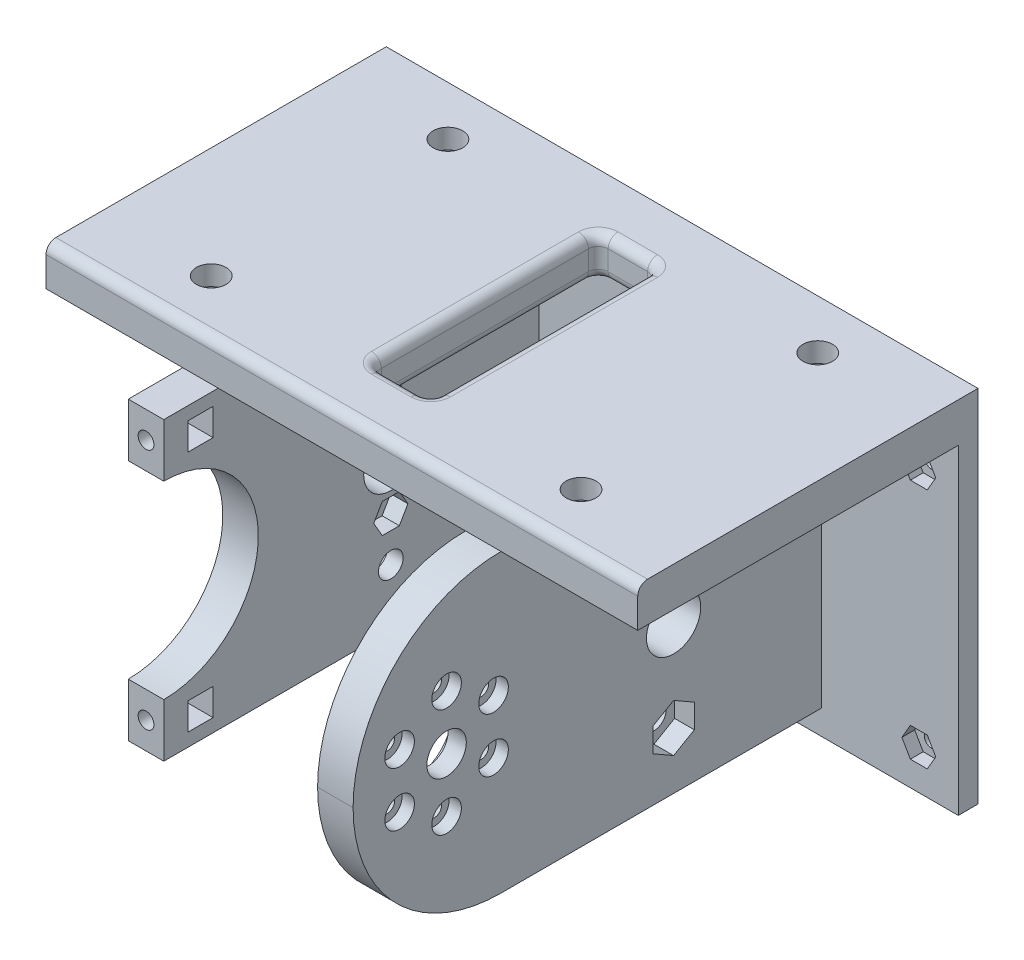
from build123d import *

# Parameters (mm, degrees)
SKETCH1_W               = 120
SKETCH1_H               = 70
SKETCH1_R               = 3
SKETCH1_W_2             = 12
SKETCH1_H_2             = 46
BOSS_EXTRUDE1_DEPTH     = 8
FILLET1_R               = 2
SKETCH2_W               = 120
SKETCH2_H               = 5
BOSS_EXTRUDE2_DEPTH     = 65
SKETCH3_W               = 7.2
SKETCH3_H               = 60
BOSS_EXTRUDE3_DEPTH     = 45
CUT_EXTRUDE1_DEPTH      = 119.172228654
CUT_EXTRUDE1_DEPTH_BACK = 119.172228654
SKETCH4_R               = 5.5
SKETCH4_R_2             = 2.5
CUT_EXTRUDE2_DEPTH      = 4
CUT_EXTRUDE3_DEPTH      = 4
CUT_EXTRUDE4_DEPTH      = 4
FILLET3_R               = 2
SKETCH10_W              = 7.2
SKETCH10_H              = 60
BOSS_EXTRUDE4_DEPTH     = 50
SKETCH11_R              = 4
CUT_EXTRUDE7_DEPTH      = 131.248514867
SKETCH13_R              = 1.5
CUT_EXTRUDE8_DEPTH      = 7.2
SKETCH16_R              = 1.5
CUT_EXTRUDE10_DEPTH     = 7.2
CUT_EXTRUDE11_DEPTH     = 3.5
SKETCH20_R              = 19.175
CUT_EXTRUDE12_DEPTH     = 7.2
SKETCH21_R              = 8.5
CUT_EXTRUDE13_DEPTH     = 3.5
CUT_EXTRUDE14_DEPTH     = 7.2
FILLET4_R               = 30
SKETCH25_R              = 3
CUT_EXTRUDE16_DEPTH     = 2.5
SKETCH26_W              = 5.1
SKETCH26_H              = 5.5
CUT_EXTRUDE17_DEPTH     = 7.2
SKETCH28_R              = 1.6
CUT_EXTRUDE18_DEPTH     = 10
SKETCH29_R              = 1.5
CUT_EXTRUDE19_DEPTH     = 10
CUT_EXTRUDE20_DEPTH     = 2.6
CHAMFER1_SIZE           = 1


with BuildPart() as part:
    # Sketch1 → Boss-Extrude1 (new body)
    with BuildSketch(Plane(origin=(0, 0, 0), x_dir=(1, 0, 0), z_dir=(0, 1, 0))):
        Rectangle(SKETCH1_W, SKETCH1_H)
        with Locations(Location((-37.5, 24, 0), (0, 0, 270))):
            Circle(SKETCH1_R, mode=Mode.SUBTRACT)
        with Locations(Location((-37.5, -24, 0), (0, 0, 90))):
            Circle(SKETCH1_R, mode=Mode.SUBTRACT)
        with Locations(Location((37.5, 24, 0), (0, 0, 90))):
            Circle(SKETCH1_R, mode=Mode.SUBTRACT)
        with Locations(Location((37.5, -24, 0), (0, 0, 270))):
            Circle(SKETCH1_R, mode=Mode.SUBTRACT)
        Rectangle(SKETCH1_W_2, SKETCH1_H_2, mode=Mode.SUBTRACT)
    extrude(amount=BOSS_EXTRUDE1_DEPTH)

    # Fillet1
    fillet1_edges = [part.edges().sort_by_distance(p)[0] for p in [
        (-6, 4, -23),
        (-6, 4, 23),
        (6, 4, 23),
        (6, 4, -23),
    ]]
    fillet(fillet1_edges, radius=FILLET1_R)

    # Sketch2 → Boss-Extrude2 (add)
    with BuildSketch(Plane.XZ):
        with Locations((0, -32.5)):
            Rectangle(SKETCH2_W, SKETCH2_H)
    extrude(amount=BOSS_EXTRUDE2_DEPTH)

    # Sketch3 → Boss-Extrude3 (add)
    with BuildSketch(Plane.XY.offset(-30)):
        with Locations((-28.675, -30)):
            Rectangle(SKETCH3_W, SKETCH3_H)
        with Locations((28.675, -30)):
            Rectangle(SKETCH3_W, SKETCH3_H)
    extrude(amount=BOSS_EXTRUDE3_DEPTH)

    # Sketch4 → Cut-Extrude1 (cut, two sides: drawn at the far end of the back side and taken through both)
    with BuildSketch(Plane.ZY.offset(32.275).offset(-CUT_EXTRUDE1_DEPTH_BACK)):
        with Locations((0, -30)):
            Circle(SKETCH4_R)
        with Locations((0, -11.5)):
            Circle(SKETCH4_R_2)
        with Locations((0, -48.5)):
            Circle(SKETCH4_R_2)
    extrude(amount=CUT_EXTRUDE1_DEPTH + CUT_EXTRUDE1_DEPTH_BACK, mode=Mode.SUBTRACT)

    # Sketch5 → Cut-Extrude2 (cut)
    with BuildSketch(Plane.ZY.offset(32.275)):
        Polygon((4.2, -9.075128869), (0, -6.650257739), (-4.2, -9.075128869), (-4.2, -13.924871131), (0, -16.349742261), (4.2, -13.924871131), align=None)
        Polygon((4.2, -46.075128869), (0, -43.650257739), (-4.2, -46.075128869), (-4.2, -50.924871131), (0, -53.349742261), (4.2, -50.924871131), align=None)
    extrude(amount=-CUT_EXTRUDE2_DEPTH, mode=Mode.SUBTRACT)

    # Sketch6 → Cut-Extrude3 (cut)
    with BuildSketch(Plane(origin=(32.275, 0, 0), x_dir=(0, 0, -1), z_dir=(1, 0, 0))):
        Polygon((4.2, -13.924871131), (4.2, -9.075128869), (0, -6.650257739), (-4.2, -9.075128869), (-4.2, -13.924871131), (0, -16.349742261), align=None)
        Polygon((-4.2, -46.075128869), (-4.2, -50.924871131), (0, -53.349742261), (4.2, -50.924871131), (4.2, -46.075128869), (0, -43.650257739), align=None)
    extrude(amount=-CUT_EXTRUDE3_DEPTH, mode=Mode.SUBTRACT)

    # Sketch7 → Cut-Extrude4 (cut)
    with BuildSketch(Plane.XZ):
        Polygon((42.7, -20.9977786), (37.5, -17.9955572), (32.3, -20.9977786), (32.3, -27.0022214), (37.5, -30.0044428), (42.7, -27.0022214), align=None)
        Polygon((42.7, 27.0022214), (37.5, 30.0044428), (32.3, 27.0022214), (32.3, 20.9977786), (37.5, 17.9955572), (42.7, 20.9977786), align=None)
        Polygon((-42.7, -27.0022214), (-42.7, -20.9977786), (-37.5, -17.9955572), (-32.3, -20.9977786), (-32.3, -27.0022214), (-37.5, -30.0044428), align=None)
        Polygon((-42.7, 20.9977786), (-42.7, 27.0022214), (-37.5, 30.0044428), (-32.3, 27.0022214), (-32.3, 20.9977786), (-37.5, 17.9955572), align=None)
    extrude(amount=-CUT_EXTRUDE4_DEPTH, mode=Mode.SUBTRACT)

    # Fillet3
    fillet3_edges = [part.edges().sort_by_distance(p)[0] for p in [
        (0, 8, 35),
        (0, 0, 23),
        (0, 8, 23),
        (6, 0, 0),
        (6, 8, 0),
        (-6, 0, 0),
        (-6, 8, 0),
        (0, 0, -23),
        (0, 8, -23),
        (5.414213562, 0, 22.414213562),
        (5.414213562, 8, 22.414213562),
        (-5.414213562, 0, 22.414213562),
        (-5.414213562, 8, 22.414213562),
        (5.414213562, 0, -22.414213562),
        (5.414213562, 8, -22.414213562),
        (-5.414213562, 0, -22.414213562),
        (-5.414213562, 8, -22.414213562),
    ]]
    fillet(fillet3_edges, radius=FILLET3_R)

    # Sketch10 → Boss-Extrude4 (add)
    with BuildSketch(Plane.XY.offset(15)):
        with Locations((-28.675, -30)):
            Rectangle(SKETCH10_W, SKETCH10_H)
        with Locations((28.675, -30)):
            Rectangle(SKETCH10_W, SKETCH10_H)
    extrude(amount=BOSS_EXTRUDE4_DEPTH)

    # Sketch11 → Cut-Extrude7 (cut, through all)
    with BuildSketch(Plane(origin=(32.275, 0, 0), x_dir=(0, 0, -1), z_dir=(1, 0, 0))):
        with Locations(Location((-46.04, -30, 0), (0, 0, 90))):
            Circle(SKETCH11_R)
    extrude(amount=-CUT_EXTRUDE7_DEPTH, mode=Mode.SUBTRACT)

    # Sketch13 → Cut-Extrude8 (cut)
    with BuildSketch(Plane(origin=(32.275, 0, 0), x_dir=(0, 0, -1), z_dir=(1, 0, 0))):
        with Locations(Location((-46.04, -19, 0), (0, 0, 90))):
            Circle(SKETCH13_R)
        with Locations(Location((-55.566279442, -24.5, 0), (0, 0, 90))):
            Circle(SKETCH13_R)
        with Locations(Location((-55.566279442, -35.5, 0), (0, 0, 90))):
            Circle(SKETCH13_R)
        with Locations(Location((-46.04, -41, 0), (0, 0, 90))):
            Circle(SKETCH13_R)
        with Locations(Location((-36.513720558, -35.5, 0), (0, 0, 90))):
            Circle(SKETCH13_R)
        with Locations(Location((-36.513720558, -24.5, 0), (0, 0, 90))):
            Circle(SKETCH13_R)
    extrude(amount=-CUT_EXTRUDE8_DEPTH, mode=Mode.SUBTRACT)

    # Sketch16 → Cut-Extrude10 (cut)
    with BuildSketch(Plane.ZY.offset(32.275)):
        with Locations(Location((0, -20.475, 0), (0, 0, 270))):
            Circle(SKETCH16_R)
        with Locations(Location((0, -39.525, 0), (0, 0, 270))):
            Circle(SKETCH16_R)
    extrude(amount=-CUT_EXTRUDE10_DEPTH, mode=Mode.SUBTRACT)

    # Sketch18 → Cut-Extrude11 (cut)
    with BuildSketch(Plane(origin=(-25.075, 0, 0), x_dir=(0, 0, -1), z_dir=(1, 0, 0))):
        Polygon((3.464101615, -20.475), (1.732050808, -17.475), (-1.732050808, -17.475), (-3.464101615, -20.475), (-1.732050808, -23.475), (1.732050808, -23.475), align=None)
        Polygon((3.464101615, -39.525), (1.732050808, -36.525), (-1.732050808, -36.525), (-3.464101615, -39.525), (-1.732050808, -42.525), (1.732050808, -42.525), align=None)
    extrude(amount=-CUT_EXTRUDE11_DEPTH, mode=Mode.SUBTRACT)

    # Sketch20 → Cut-Extrude12 (cut)
    with BuildSketch(Plane.ZY.offset(32.275)):
        with Locations((46.04, -30)):
            Circle(SKETCH20_R)
    extrude(amount=-CUT_EXTRUDE12_DEPTH, mode=Mode.SUBTRACT)

    # Sketch21 → Cut-Extrude13 (cut)
    with BuildSketch(Plane.ZY.offset(-25.075)):
        with Locations((46.04, -30)):
            Circle(SKETCH21_R)
    extrude(amount=-CUT_EXTRUDE13_DEPTH, mode=Mode.SUBTRACT)

    # Sketch22 → Cut-Extrude14 (cut)
    with BuildSketch(Plane.ZY.offset(32.275)):
        Polygon((46.04, -30), (46.04, 0), (65, 0), (65, -60), (46.04, -60), align=None)
    extrude(amount=-CUT_EXTRUDE14_DEPTH, mode=Mode.SUBTRACT)

    # Fillet4
    fillet4_edges = [part.edges().sort_by_distance(p)[0] for p in [
        (28.675, 0, 65),
        (28.675, -60, 65),
    ]]
    fillet(fillet4_edges, radius=FILLET4_R - 0.0001)  # a hair under: the kernel refuses the full size

    # Sketch25 → Cut-Extrude16 (cut)
    with BuildSketch(Plane(origin=(32.275, 0, 0), x_dir=(0, 0, -1), z_dir=(1, 0, 0))):
        with Locations(Location((-55.566279442, -24.5, 0), (0, 0, 90))):
            Circle(SKETCH25_R)
        with Locations(Location((-46.04, -19, 0), (0, 0, 90))):
            Circle(SKETCH25_R)
        with Locations(Location((-36.513720558, -24.5, 0), (0, 0, 90))):
            Circle(SKETCH25_R)
        with Locations(Location((-36.513720558, -35.5, 0), (0, 0, 90))):
            Circle(SKETCH25_R)
        with Locations(Location((-46.04, -41, 0), (0, 0, 90))):
            Circle(SKETCH25_R)
        with Locations(Location((-55.566279442, -35.5, 0), (0, 0, 90))):
            Circle(SKETCH25_R)
    extrude(amount=-CUT_EXTRUDE16_DEPTH, mode=Mode.SUBTRACT)

    # Sketch26 → Cut-Extrude17 (cut)
    with BuildSketch(Plane.ZY.offset(32.275)):
        with Locations((38.59, -5.4125)):
            Rectangle(SKETCH26_W, SKETCH26_H)
        with Locations((38.59, -54.5875)):
            Rectangle(SKETCH26_W, SKETCH26_H)
    extrude(amount=-CUT_EXTRUDE17_DEPTH, mode=Mode.SUBTRACT)

    # Sketch28 → Cut-Extrude18 (cut)
    with BuildSketch(Plane.XY.offset(46.04)):
        with Locations((-28.675, -5.4125)):
            Circle(SKETCH28_R)
        with Locations((-28.675, -54.5875)):
            Circle(SKETCH28_R)
    extrude(amount=-CUT_EXTRUDE18_DEPTH, mode=Mode.SUBTRACT)

    # Sketch29 → Cut-Extrude19 (cut)
    with BuildSketch(Plane.XY.offset(-30)):
        with Locations((-52, -8)):
            Circle(SKETCH29_R)
        with Locations((-52, -57)):
            Circle(SKETCH29_R)
        with Locations((52, -57)):
            Circle(SKETCH29_R)
        with Locations((52, -8)):
            Circle(SKETCH29_R)
    extrude(amount=-CUT_EXTRUDE19_DEPTH, mode=Mode.SUBTRACT)

    # Sketch30 → Cut-Extrude20 (cut)
    with BuildSketch(Plane.XY.offset(-30)):
        Polygon((-48.564765898, -8), (-50.282382949, -5.025), (-53.717617051, -5.025), (-55.435234102, -8), (-53.717617051, -10.975), (-50.282382949, -10.975), align=None)
        Polygon((-48.564765898, -57), (-50.282382949, -54.025), (-53.717617051, -54.025), (-55.435234102, -57), (-53.717617051, -59.975), (-50.282382949, -59.975), align=None)
        Polygon((55.435234102, -57), (53.717617051, -54.025), (50.282382949, -54.025), (48.564765898, -57), (50.282382949, -59.975), (53.717617051, -59.975), align=None)
        Polygon((55.435234102, -8), (53.717617051, -5.025), (50.282382949, -5.025), (48.564765898, -8), (50.282382949, -10.975), (53.717617051, -10.975), align=None)
    extrude(amount=-CUT_EXTRUDE20_DEPTH, mode=Mode.SUBTRACT)

    # Chamfer1
    chamfer1_edges = [part.edges().sort_by_distance(p)[0] for p in [
        (0, -65, -35),
        (-60, -28.5, -35),
        (60, -28.5, -35),
        (0, 8, -35),
    ]]
    chamfer(chamfer1_edges, length=CHAMFER1_SIZE)


solid = part.part
